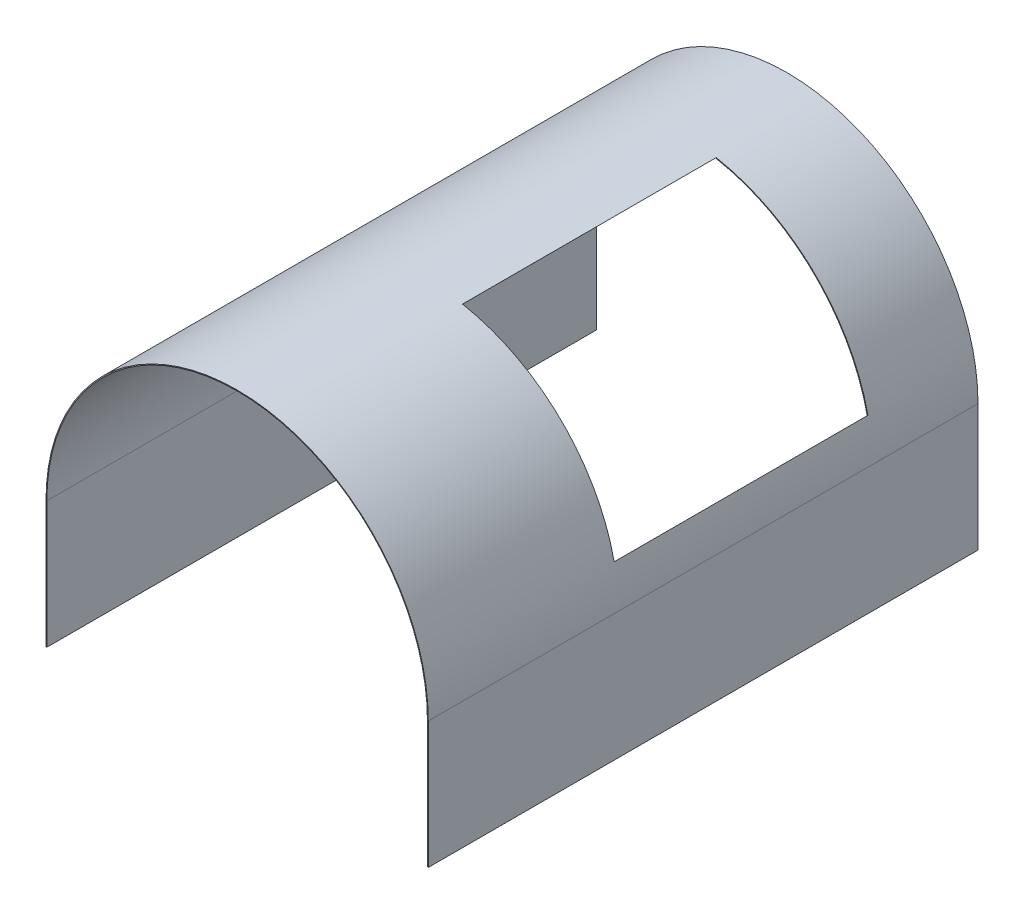
from build123d import *

# Parameters (mm, degrees)
BOSS_EXTRUDE1_DEPTH = 660.4
CUT_EXTRUDE1_DEPTH  = 660.4
SKETCH3_W           = 254
SKETCH3_H           = 304.8
CUT_EXTRUDE2_DEPTH  = 152.4


with BuildPart() as part:
    # Sketch1 → Boss-Extrude1 (new body)
    with BuildSketch(Plane.XY):
        with BuildLine():
            Line((-228.6, -36.83), (-228.6, -189.23))
            Line((-228.6, -189.23), (230.632, -189.23))
            Line((230.632, -189.23), (230.632, -36.83))
            ThreePointArc((230.632, -36.83), (1.016, 192.786), (-228.6, -36.83))
        make_face()
    extrude(amount=BOSS_EXTRUDE1_DEPTH)

    # Sketch2 → Cut-Extrude1 (cut)
    with BuildSketch(Plane.XY.offset(660.4)):
        with BuildLine():
            Line((-227.584, -36.83), (-227.584, -189.23))
            Line((-227.584, -189.23), (229.616, -189.23))
            Line((229.616, -189.23), (229.616, -36.83))
            ThreePointArc((229.616, -36.83), (1.016, 191.77), (-227.584, -36.83))
        make_face()
    extrude(amount=-CUT_EXTRUDE1_DEPTH, mode=Mode.SUBTRACT)

    # Sketch3 → Cut-Extrude2 (cut)
    with BuildSketch(Plane(origin=(96.389804427, 96.818203557, 0), x_dir=(0.7086729033899728, -0.7055371825785132, 0), z_dir=(0.7055371825785132, 0.7086729033899728, 0))):
        with Locations((24.327583489, -279.4)):
            Rectangle(SKETCH3_W, SKETCH3_H)
    extrude(amount=CUT_EXTRUDE2_DEPTH, mode=Mode.SUBTRACT)


solid = part.part
